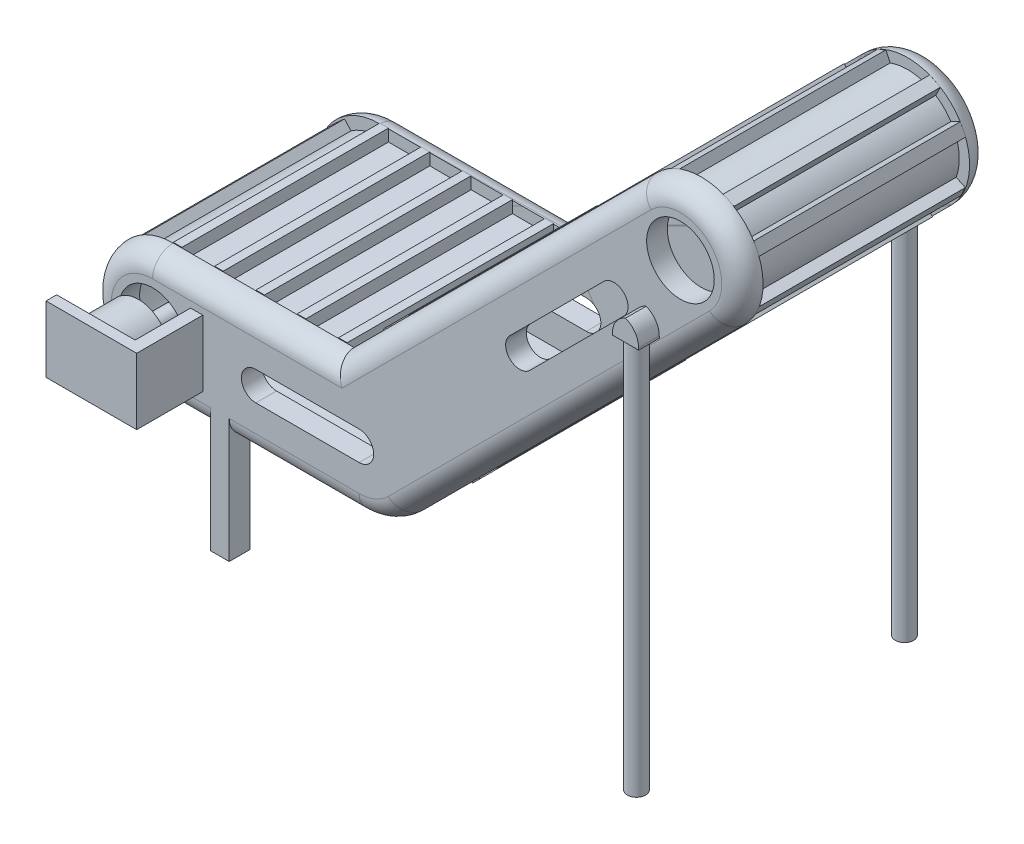
from build123d import *

# Parameters (mm, degrees)
SKETCH1_R            = 8.183812147
SKETCH1_R_2          = 8.13814142
BOSS_EXTRUDE1_DEPTH  = 5
SKETCH3_W            = 4.564395245
SKETCH3_H            = 5
BOSS_EXTRUDE5_DEPTH  = 55
FILLET1_R            = 5
FILLET2_R            = 5
BOSS_EXTRUDE6_START  = -25
BOSS_EXTRUDE6_DEPTH  = 50
SKETCH6_W            = 6.32686376
SKETCH6_H            = 5.483281925
BOSS_EXTRUDE7_DEPTH  = 5
FILLET4_R            = 5
SKETCH7_R            = 2.21608037
BOSS_EXTRUDE8_DEPTH  = 95
SKETCH8_W            = 2.952536421
SKETCH8_H            = 16.028054858
BOSS_EXTRUDE12_DEPTH = 16
SKETCH10_W           = 2.581076065
SKETCH10_H           = 16.028054858
BOSS_EXTRUDE13_DEPTH = 19
SKETCH11_R           = 7.397871668
BOSS_EXTRUDE14_DEPTH = 10
SKETCH12_R           = 2.290909412
BOSS_EXTRUDE15_DEPTH = 8.418924


# Some blends are built 0.0001 mm under size
with BuildPart() as part:
    # Sketch1 → Boss-Extrude1 (new body)
    with BuildSketch(Plane.XY):
        with BuildLine():
            Line((60.606601718, -10.606601718), (138.388347648, 67.175144213))
            ThreePointArc((138.388347648, 67.175144213), (138.388347648, 88.388347648), (117.175144213, 88.388347648))
            Line((117.175144213, 88.388347648), (43.786796564, 15))
            Line((43.786796564, 15), (0, 15))
            ThreePointArc((0, 15), (-15, 0), (0, -15))
            Line((0, -15), (50, -15))
            ThreePointArc((50, -15), (55.740251485, -13.858192988), (60.606601718, -10.606601718))
        make_face()
        with Locations((127.781745931, 77.781745931)):
            Circle(SKETCH1_R, mode=Mode.SUBTRACT)
        Circle(SKETCH1_R_2, mode=Mode.SUBTRACT)
        with BuildLine():
            ThreePointArc((114.090817949, 59.241010407), (114.090817949, 64.090817949), (109.241010407, 64.090817949))
            Line((109.241010407, 64.090817949), (86.465969194, 41.315776736))
            ThreePointArc((86.465969194, 41.315776736), (86.465969194, 36.465969194), (91.315776736, 36.465969194))
            Line((91.315776736, 36.465969194), (114.090817949, 59.241010407))
        make_face(mode=Mode.SUBTRACT)
        with BuildLine():
            ThreePointArc((50, -3.51254377), (53.51254377, 0), (50, 3.51254377))
            Line((50, 3.51254377), (25, 3.51254377))
            ThreePointArc((25, 3.51254377), (21.48745623, 0), (25, -3.51254377))
            Line((25, -3.51254377), (50, -3.51254377))
        make_face(mode=Mode.SUBTRACT)
    extrude(amount=BOSS_EXTRUDE1_DEPTH)

    # Sketch3 → Boss-Extrude5 (add)
    with BuildSketch(Plane(origin=(0, 15, 0), x_dir=(1, 0, 0), z_dir=(0, 1, 0))):
        with Locations((16.262400844, -2.5)):
            Rectangle(SKETCH3_W, SKETCH3_H)
    extrude(amount=-BOSS_EXTRUDE5_DEPTH)

    # Fillet1
    fillet1_edges = [part.edges().sort_by_distance(p)[0] for p in [
        (6.99010161, -15, 5),
        (-15, 0, 5),
        (21.893398282, 15, 5),
    ]]
    fillet(fillet1_edges, radius=FILLET1_R - 0.0001)  # a hair under: the kernel refuses the full size

    # Fillet2
    fillet2_edges = [part.edges().sort_by_distance(p)[0] for p in [
        (34.272299233, -15, 5),
        (55.740251485, -13.858192988, 5),
        (99.497474683, 28.284271247, 5),
        (138.388347648, 88.388347648, 5),
        (77.981020389, 49.194223824, 5),
    ]]
    fillet(fillet2_edges, radius=FILLET2_R - 0.0001)  # a hair under: the kernel refuses the full size


with BuildPart() as body_2:
    # Mirror6: mirrored copy
    add(part.part.mirror(Plane.XY.offset(-25)))


with BuildPart() as body_3:
    # Sketch5 → Boss-Extrude6 (new body)
    with BuildSketch(Plane.XY.offset(-25).offset(BOSS_EXTRUDE6_START)):
        with BuildLine():
            Line((10, 12.226727758), (2.09850358, 12.226727758))
            Line((2.09850358, 12.226727758), (2.09850358, 15.157870518))
            Line((2.09850358, 15.157870518), (0, 15.157870518))
            Line((0, 15.157870518), (0, 12.226727758))
            ThreePointArc((0, 12.226727758), (-3.661032508, 11.665749553), (-6.98611913, 10.034291762))
            Line((-6.98611913, 10.034291762), (-8.535670925, 11.759977617))
            Line((-8.535670925, 11.759977617), (-10.776747081, 9.747639408))
            Line((-10.776747081, 9.747639408), (-9.227195286, 8.021953553))
            ThreePointArc((-9.227195286, 8.021953553), (-11.128473984, 5.064576827), (-12.109585901, 1.688431511))
            Line((-12.109585901, 1.688431511), (-15.583083379, 1.688431511))
            Line((-15.583083379, 1.688431511), (-15.583083379, -1.688431511))
            Line((-15.583083379, -1.688431511), (-12.109585901, -1.688431511))
            ThreePointArc((-12.109585901, -1.688431511), (-11.607795937, -3.840826103), (-10.726727758, -5.867723858))
            Line((-10.726727758, -5.867723858), (-15.056630132, -8.881714995))
            Line((-15.056630132, -8.881714995), (-13.55709766, -11.03594469))
            Line((-13.55709766, -11.03594469), (-9.227195286, -8.021953553))
            ThreePointArc((-9.227195286, -8.021953553), (-5.070040901, -11.125985661), (0, -12.226727758))
            Line((0, -12.226727758), (0, -15.157870518))
            Line((0, -15.157870518), (2.09850358, -15.157870518))
            Line((2.09850358, -15.157870518), (2.09850358, -12.228565419))
            Line((2.09850358, -12.228565419), (10, -12.235484765))
            Line((10, -12.235484765), (10, -15.157870518))
            Line((10, -15.157870518), (12.09850358, -15.157870518))
            Line((12.09850358, -15.157870518), (12.09850358, -12.237322426))
            Line((12.09850358, -12.237322426), (20, -12.244241772))
            Line((20, -12.244241772), (20, -15.157870518))
            Line((20, -15.157870518), (22.09850358, -15.157870518))
            Line((22.09850358, -15.157870518), (22.09850358, -12.246079434))
            Line((22.09850358, -12.246079434), (30, -12.25299878))
            Line((30, -12.25299878), (30, -15.157870518))
            Line((30, -15.157870518), (32.09850358, -15.157870518))
            Line((32.09850358, -15.157870518), (32.09850358, -12.254836441))
            Line((32.09850358, -12.254836441), (40, -12.261755787))
            Line((40, -12.261755787), (40, -15.157870518))
            Line((40, -15.157870518), (42.09850358, -15.157870518))
            Line((42.09850358, -15.157870518), (42.09850358, -12.263593448))
            Line((42.09850358, -12.263593448), (47.632045799, -12.268439175))
            Line((47.632045799, -12.268439175), (49.993032969, -12.270506693))
            Line((49.993032969, -12.270506693), (49.993605655, -12.494869587))
            Line((49.993605655, -12.494869587), (50, -15))
            Line((50, -15), (52.554940298, -14.993478515))
            Line((52.554940298, -14.993478515), (52.547973267, -12.263985208))
            Line((52.547973267, -12.263985208), (52.388830251, -12.264391421))
            ThreePointArc((52.388830251, -12.264391421), (55.868098846, -11.031193173), (58.835208172, -8.835208172))
            Line((58.835208172, -8.835208172), (60.606601718, -10.606601718))
            Line((60.606601718, -10.606601718), (62.490857301, -8.722346135))
            Line((62.490857301, -8.722346135), (60.719463755, -6.950952589))
            Line((60.719463755, -6.950952589), (65.180205241, -2.490211103))
            Line((65.180205241, -2.490211103), (66.661985905, -3.972918387))
            Line((66.661985905, -3.972918387), (68.438150656, -2.197863652))
            Line((68.438150656, -2.197863652), (66.955815157, -0.714601187))
            Line((66.955815157, -0.714601187), (70.48892305, 2.818506705))
            Line((70.48892305, 2.818506705), (72.430532121, 0.875683464))
            Line((72.430532121, 0.875683464), (74.189012709, 2.633065087))
            Line((74.189012709, 2.633065087), (72.246854327, 4.576437982))
            Line((72.246854327, 4.576437982), (76.486811073, 8.816394728))
            Line((76.486811073, 8.816394728), (78.339827941, 6.962219091))
            Line((78.339827941, 6.962219091), (81.538432257, 10.158824436))
            Line((81.538432257, 10.158824436), (79.684416216, 12.013999871))
            Line((79.684416216, 12.013999871), (84.816077606, 17.145661262))
            Line((84.816077606, 17.145661262), (86.671697166, 15.288881306))
            Line((86.671697166, 15.288881306), (88.539879269, 17.155895886))
            Line((88.539879269, 17.155895886), (86.683676131, 19.013259786))
            Line((86.683676131, 19.013259786), (92.114400744, 24.443984399))
            Line((92.114400744, 24.443984399), (93.972300851, 22.58492247))
            Line((93.972300851, 22.58492247), (96.150496519, 24.761756872))
            Line((96.150496519, 24.761756872), (94.291915992, 26.621499647))
            Line((94.291915992, 26.621499647), (99.488350914, 31.81793457))
            Line((99.488350914, 31.81793457), (101.3485552, 29.956567021))
            Line((101.3485552, 29.956567021), (103.147354313, 31.754241972))
            Line((103.147354313, 31.754241972), (101.286588122, 33.616171778))
            Line((101.286588122, 33.616171778), (106.551876336, 38.881459992))
            Line((106.551876336, 38.881459992), (108.4142878, 37.017883884))
            Line((108.4142878, 37.017883884), (110.198275765, 38.800756944))
            Line((110.198275765, 38.800756944), (108.335307023, 40.664890679))
            Line((108.335307023, 40.664890679), (114.136260847, 46.465844502))
            Line((114.136260847, 46.465844502), (116.001042245, 44.599896979))
            Line((116.001042245, 44.599896979), (117.681962674, 46.279766915))
            Line((117.681962674, 46.279766915), (115.816656194, 48.146239849))
            Line((115.816656194, 48.146239849), (121.987839228, 54.317422884))
            Line((121.987839228, 54.317422884), (123.855074052, 52.4490204))
            Line((123.855074052, 52.4490204), (125.660835597, 54.253653432))
            Line((125.660835597, 54.253653432), (123.793036693, 56.122620349))
            Line((123.793036693, 56.122620349), (129.971733371, 62.301317027))
            Line((129.971733371, 62.301317027), (131.841462966, 60.430418212))
            Line((131.841462966, 60.430418212), (133.830297381, 62.418009703))
            Line((133.830297381, 62.418009703), (131.959946518, 64.289530174))
            Line((131.959946518, 64.289530174), (136.616954387, 68.946538043))
            ThreePointArc((136.616954387, 68.946538043), (137.650548097, 70.118290398), (138.529820639, 71.409878312))
            Line((138.529820639, 71.409878312), (140.749652155, 70.365201716))
            Line((140.749652155, 70.365201716), (141.761945305, 72.516221704))
            Line((141.761945305, 72.516221704), (139.542113789, 73.560898299))
            ThreePointArc((139.542113789, 73.560898299), (140.276617154, 77.781745931), (139.542113789, 82.002593562))
            Line((139.542113789, 82.002593562), (141.824782763, 83.134585866))
            Line((141.824782763, 83.134585866), (140.542187036, 85.720947506))
            Line((140.542187036, 85.720947506), (138.259518062, 84.588955202))
            ThreePointArc((138.259518062, 84.588955202), (136.616954103, 86.616954103), (134.588955202, 88.259518062))
            Line((134.588955202, 88.259518062), (135.720947506, 90.542187036))
            Line((135.720947506, 90.542187036), (133.134585866, 91.824782763))
            Line((133.134585866, 91.824782763), (132.002593562, 89.542113789))
            ThreePointArc((132.002593562, 89.542113789), (127.781745931, 90.276617154), (123.560898299, 89.542113789))
            Line((123.560898299, 89.542113789), (122.516221704, 91.761945305))
            Line((122.516221704, 91.761945305), (120.365201716, 90.749652155))
            Line((120.365201716, 90.749652155), (121.409878312, 88.529820639))
            ThreePointArc((121.409878312, 88.529820639), (120.108310868, 87.642790562), (118.928680434, 86.599060613))
            Line((118.928680434, 86.599060613), (114.290998784, 81.958478826))
            Line((114.290998784, 81.958478826), (112.418009703, 83.830297381))
            Line((112.418009703, 83.830297381), (110.430418212, 81.841462966))
            Line((110.430418212, 81.841462966), (112.303407293, 79.969644411))
            Line((112.303407293, 79.969644411), (106.126642514, 73.789017042))
            Line((106.126642514, 73.789017042), (104.253653432, 75.660835597))
            Line((104.253653432, 75.660835597), (102.4490204, 73.855074052))
            Line((102.4490204, 73.855074052), (104.322009481, 71.983255497))
            Line((104.322009481, 71.983255497), (98.152755996, 65.810144119))
            Line((98.152755996, 65.810144119), (96.279766915, 67.681962674))
            Line((96.279766915, 67.681962674), (94.599896979, 66.001042245))
            Line((94.599896979, 66.001042245), (96.47288606, 64.12922369))
            Line((96.47288606, 64.12922369), (90.673746025, 58.326457211))
            Line((90.673746025, 58.326457211), (88.800756944, 60.198275765))
            Line((88.800756944, 60.198275765), (87.017883884, 58.4142878))
            Line((87.017883884, 58.4142878), (88.890872965, 56.542469245))
            Line((88.890872965, 56.542469245), (83.627231054, 51.275535758))
            Line((83.627231054, 51.275535758), (81.754241972, 53.147354313))
            Line((81.754241972, 53.147354313), (79.956567021, 51.3485552))
            Line((79.956567021, 51.3485552), (81.829556102, 49.476736645))
            Line((81.829556102, 49.476736645), (76.634745954, 44.278677964))
            Line((76.634745954, 44.278677964), (74.761756872, 46.150496519))
            Line((74.761756872, 46.150496519), (72.58492247, 43.972300851))
            Line((72.58492247, 43.972300851), (74.457911551, 42.100482296))
            Line((74.457911551, 42.100482296), (69.028884968, 36.668060715))
            Line((69.028884968, 36.668060715), (67.155895886, 38.539879269))
            Line((67.155895886, 38.539879269), (65.288881306, 36.671697166))
            Line((65.288881306, 36.671697166), (67.161870387, 34.799878611))
            Line((67.161870387, 34.799878611), (62.031813517, 29.666613702))
            Line((62.031813517, 29.666613702), (60.158824436, 31.538432257))
            Line((60.158824436, 31.538432257), (56.962219091, 28.339827941))
            Line((56.962219091, 28.339827941), (58.835208172, 26.468009386))
            Line((58.835208172, 26.468009386), (54.596577137, 22.226727758))
            Line((54.596577137, 22.226727758), (52.633065087, 24.189012709))
            Line((52.633065087, 24.189012709), (50.875683464, 22.430532121))
            Line((50.875683464, 22.430532121), (52.839195514, 20.46824717))
            Line((52.839195514, 20.46824717), (49.307192322, 16.934035268))
            Line((49.307192322, 16.934035268), (47.802136348, 18.438150656))
            Line((47.802136348, 18.438150656), (46.027081613, 16.661985905))
            Line((46.027081613, 16.661985905), (47.532137587, 15.157870518))
            ThreePointArc((47.532137587, 15.157870518), (45.034106518, 13.334758441), (42.09850358, 12.362065139))
            Line((42.09850358, 12.362065139), (42.09850358, 15.157870518))
            Line((42.09850358, 15.157870518), (40, 15.157870518))
            Line((40, 15.157870518), (40, 12.226727758))
            Line((40, 12.226727758), (32.09850358, 12.226727758))
            Line((32.09850358, 12.226727758), (32.09850358, 15.157870518))
            Line((32.09850358, 15.157870518), (30, 15.157870518))
            Line((30, 15.157870518), (30, 12.226727758))
            Line((30, 12.226727758), (22.09850358, 12.226727758))
            Line((22.09850358, 12.226727758), (22.09850358, 15.157870518))
            Line((22.09850358, 15.157870518), (20, 15.157870518))
            Line((20, 15.157870518), (20, 12.226727758))
            Line((20, 12.226727758), (12.09850358, 12.226727758))
            Line((12.09850358, 12.226727758), (12.09850358, 15.157870518))
            Line((12.09850358, 15.157870518), (10, 15.157870518))
            Line((10, 15.157870518), (10, 12.226727758))
        make_face()
        with BuildLine():
            ThreePointArc((0, -10.726727758), (-10.726727758, 0), (0, 10.726727758))
            Line((0, 10.726727758), (37.513872687, 10.726727758))
            ThreePointArc((37.513872687, 10.726727758), (38.36090671, 10.693232521), (39.202650843, 10.592955996))
            ThreePointArc((39.202650843, 10.592955996), (43.862360491, 10.956115623), (47.848083358, 13.397179359))
            Line((47.848083358, 13.397179359), (120.00719793, 85.556293931))
            ThreePointArc((120.00719793, 85.556293931), (135.556293931, 85.556293931), (135.556293931, 70.00719793))
            Line((135.556293931, 70.00719793), (57.751300431, -7.79779557))
            ThreePointArc((57.751300431, -7.79779557), (54.507066943, -9.965523083), (50.680232619, -10.726727758))
            Line((50.680232619, -10.726727758), (0, -10.726727758))
        make_face(mode=Mode.SUBTRACT)
    extrude(amount=BOSS_EXTRUDE6_DEPTH)



with BuildPart() as part_1:
    add(part.part)

    # Sketch6 → Boss-Extrude7 (add)
    with BuildSketch(Plane.XY.offset(5)):
        with Locations((119.486627819, 61.610414561)):
            Rectangle(SKETCH6_W, SKETCH6_H)
    extrude(amount=BOSS_EXTRUDE7_DEPTH)

    # Fillet4
    # the kernel refuses this fillet: 5 mm, written as the material it takes off along each edge
    with BuildSketch(Plane(origin=(116.323195939, 64.352055523, 5), x_dir=(1, 0, 0), z_dir=(0, 0, 1)), Plane(origin=(122.650059699, 64.352055523, 5), x_dir=(0, -1, 0), z_dir=(0, 0, 1))) as fillet4_piece_1:
        with BuildLine():
            CenterArc((FILLET4_R, -FILLET4_R), FILLET4_R, 90, 90)
            Line((0, -FILLET4_R), (0, 0))
            Line((0, 0), (FILLET4_R, 0))
        make_face()
    extrude(amount=17.5, mode=Mode.SUBTRACT)

    # Sketch7 → Boss-Extrude8 (add)
    with BuildSketch(Plane.XZ.offset(-58.868773598)):
        with Locations(Location((119.575905804, 7.431918324, 0), (0, 0, 90))):
            Circle(SKETCH7_R)
    extrude(amount=BOSS_EXTRUDE8_DEPTH)


with BuildPart() as body_4:
    # Mirror8: mirrored copy
    add(part_1.part.mirror(Plane.XY.offset(-25)))


with BuildPart() as part_2:
    add(part_1.part)

    # Sketch8 → Boss-Extrude12 (add)
    with BuildSketch(Plane.XY.offset(5)):
        with Locations((10.664571154, 0.450731551)):
            Rectangle(SKETCH8_W, SKETCH8_H)
    extrude(amount=BOSS_EXTRUDE12_DEPTH)

    # Sketch10 → Boss-Extrude13 (add)
    with BuildSketch(Plane.ZY.offset(-9.188302943)):
        with Locations((19.709461968, 0.450731551)):
            Rectangle(SKETCH10_W, SKETCH10_H)
    extrude(amount=BOSS_EXTRUDE13_DEPTH)

    # Sketch11 → Boss-Extrude14 (add)
    with BuildSketch(Plane(origin=(0, 0, 18.418923935), x_dir=(-1, 0, 0), z_dir=(0, 0, -1))):
        with Locations(Location((0, 0, 0), (0, 0, 180))):
            Circle(SKETCH11_R)
    extrude(amount=BOSS_EXTRUDE14_DEPTH)


with BuildPart() as body_3_1:
    add(body_3.part)

    add(part_2.part)  # Boss-Extrude15 merges part
    # Sketch12 → Boss-Extrude15 (add)
    with BuildSketch(Plane(origin=(0, 0, 8.418923935), x_dir=(-1, 0, 0), z_dir=(0, 0, -1))):
        Circle(SKETCH12_R)
    extrude(amount=BOSS_EXTRUDE15_DEPTH)


solid = Compound([body_2.part, body_4.part, body_3_1.part])
